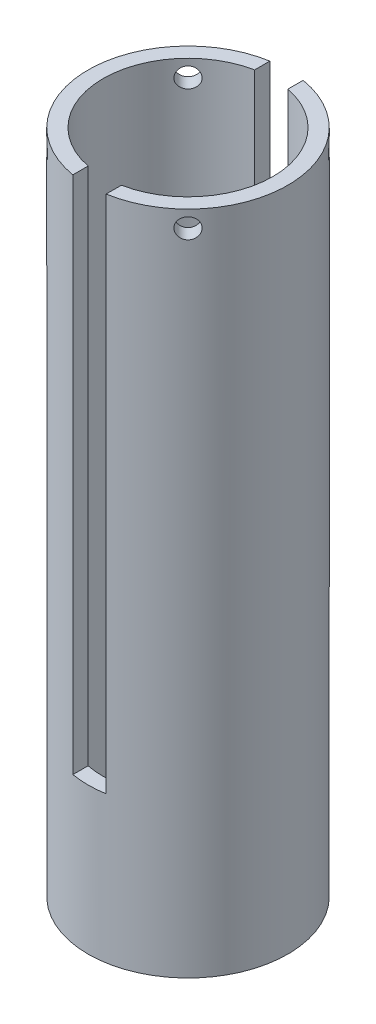
from build123d import *

# Parameters (mm, degrees)
SKETCH1_R                            = 3
SKETCH1_R_2                          = 2.55
BOSS_EXTRUDE1_DEPTH                  = 20
CUT_EXTRUDE1_DEPTH                   = 21.4450483
CUT_EXTRUDE1_DEPTH_BACK              = 21.4450483
SKETCH2_W                            = 1
SKETCH2_H                            = 15.6
F_0_6_0_6_DIAMETER_HOLE1_D           = 0.6
F_0_6_0_6_DIAMETER_HOLE1_ON_FACE_2_D = 0.6
F_0_6_0_6_DIAMETER_HOLE1_ON_FACE_3_D = 0.6
F_0_6_0_6_DIAMETER_HOLE1_ON_FACE_4_D = 0.6


with BuildPart() as part:
    # Sketch1 → Boss-Extrude1 (new body)
    with BuildSketch(Plane(origin=(0, 0, 0), x_dir=(1, 0, 0), z_dir=(0, 1, 0))):
        Circle(SKETCH1_R)
        Circle(SKETCH1_R_2, mode=Mode.SUBTRACT)
    extrude(amount=BOSS_EXTRUDE1_DEPTH)

    # Sketch2 → Cut-Extrude1 (cut, two sides: drawn at the far end of the back side and taken through both)
    with BuildSketch(Plane.XY.offset(-CUT_EXTRUDE1_DEPTH_BACK)):
        with Locations((0, 12.2)):
            Rectangle(SKETCH2_W, SKETCH2_H)
    extrude(amount=CUT_EXTRUDE1_DEPTH + CUT_EXTRUDE1_DEPTH_BACK, mode=Mode.SUBTRACT)

    # Ø0.6 (0.6) Diameter Hole1 (through all)
    with Locations(Plane(origin=(2.121320344, 19.5, 2.121320344), x_dir=(0.707106781187, 0, -0.707106781187), z_dir=(0.707106781187, 0, 0.707106781187))):
        with Locations((0, 0)):
            Hole(F_0_6_0_6_DIAMETER_HOLE1_D / 2)

    # Ø0.6 (0.6) Diameter Hole1 on face 2 (through all)
    with Locations(Plane(origin=(2.121320344, 19.5, -2.121320344), x_dir=(-0.707106781187, 0, -0.707106781187), z_dir=(0.707106781187, 0, -0.707106781187))):
        with Locations((0, 0)):
            Hole(F_0_6_0_6_DIAMETER_HOLE1_ON_FACE_2_D / 2)

    # Ø0.6 (0.6) Diameter Hole1 on face 3 (through all)
    with Locations(Plane(origin=(-2.121320344, 19.5, 2.121320344), x_dir=(0.707106781187, 0, 0.707106781187), z_dir=(-0.707106781187, 0, 0.707106781187))):
        with Locations((0, 0)):
            Hole(F_0_6_0_6_DIAMETER_HOLE1_ON_FACE_3_D / 2)

    # Ø0.6 (0.6) Diameter Hole1 on face 4 (through all)
    with Locations(Plane(origin=(-2.121320344, 19.5, -2.121320344), x_dir=(-0.707106781187, 0, 0.707106781187), z_dir=(-0.707106781187, 0, -0.707106781187))):
        with Locations((0, 0)):
            Hole(F_0_6_0_6_DIAMETER_HOLE1_ON_FACE_4_D / 2)


solid = part.part
